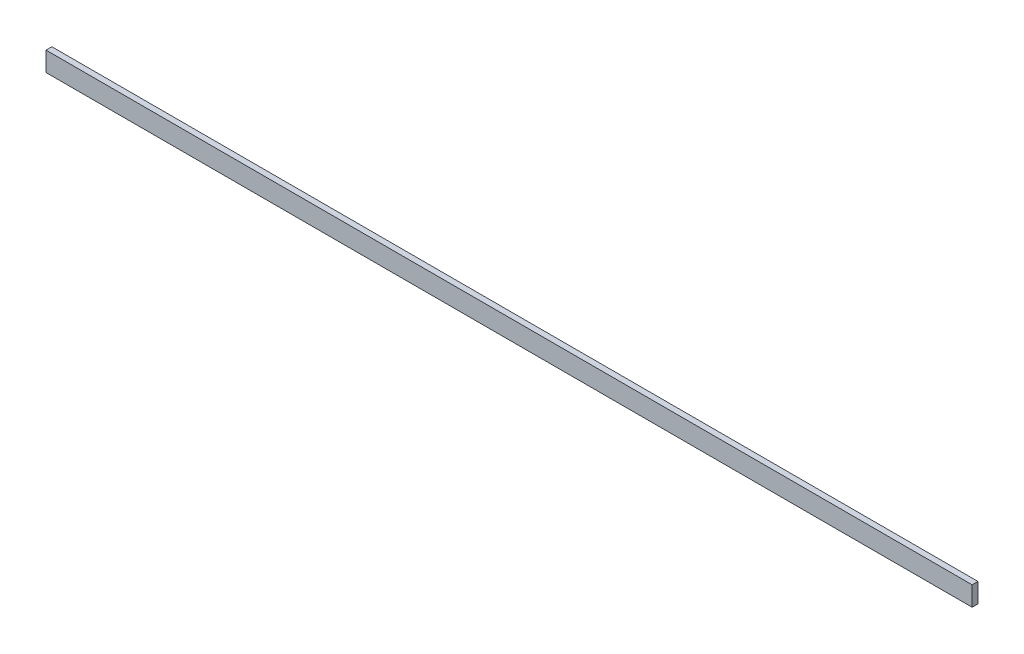
from build123d import *

# Parameters (mm, degrees)
IZIM1_W            = 2380
IZIM1_H            = 50
TABAN_FLAN_1_DEPTH = 15


# Sheet-metal steps are written as plain solids
with BuildPart() as part:
    # Çizim1 → Taban-Flanş1 (new body)
    with BuildSketch(Plane.XY):
        with Locations((1190, -25)):
            Rectangle(IZIM1_W, IZIM1_H)
    extrude(amount=-TABAN_FLAN_1_DEPTH)


solid = part.part
